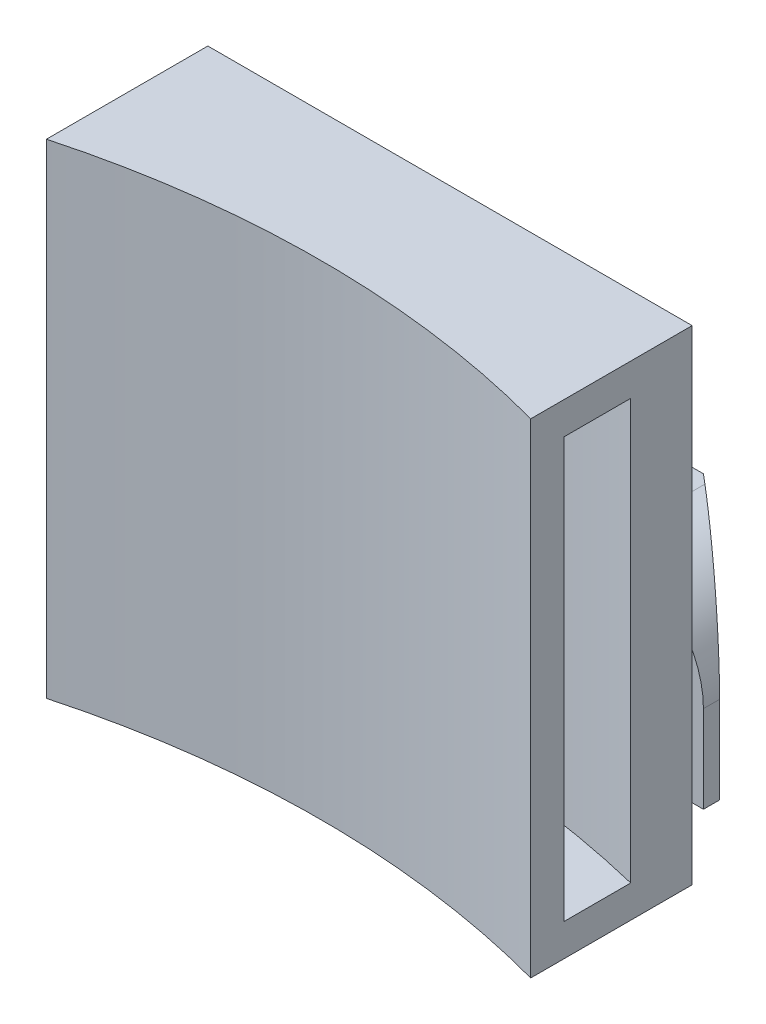
from build123d import *

# Parameters (mm, degrees)
BOSS_EXTRUDE1_DEPTH           = 7.5
CUT_EXTRUDE2_DEPTH            = 9.3
FILLET1_R                     = 3
FILLET2_R                     = 0.7
SKETCH3_W                     = 6
SKETCH3_H                     = 4
BOSS_EXTRUDE2_DEPTH           = 1
BOSS_EXTRUDE2_TAPER           = 45
SKETCH5_R                     = 0.75
BOSS_EXTRUDE3_DEPTH           = 0.6
BOSS_EXTRUDE3_DRAFT           = 35
BOSS_EXTRUDE3_PROFILE_2_DEPTH = 0.6
BOSS_EXTRUDE3_PROFILE_2_DRAFT = 35
CUT_EXTRUDE3_DEPTH            = 6.5


with BuildPart() as part:
    # Sketch1 → Boss-Extrude1 (new, symmetric)
    with BuildSketch(Plane(origin=(0, 0, 0), x_dir=(1, 0, 0), z_dir=(0, 1, 0))):
        with BuildLine():
            Line((-2.35, 5.5), (2.35, 5.5))
            Line((2.35, 5.5), (5.65, 2.7))
            Line((5.65, 2.7), (5.65, 2.2))
            Line((5.65, 2.2), (2.5, 2.2))
            Line((2.5, 2.2), (2.5, 0))
            Line((2.5, 0), (7.5, 0))
            Line((7.5, 0), (7.5, -5))
            ThreePointArc((7.5, -5), (0, -4), (-7.5, -5))
            Line((-7.5, -5), (-7.5, 0))
            Line((-7.5, 0), (-2.5, 0))
            Line((-2.5, 0), (-2.5, 2.2))
            Line((-2.5, 2.2), (-5.65, 2.2))
            Line((-5.65, 2.2), (-5.65, 2.7))
            Line((-5.65, 2.7), (-2.35, 5.5))
        make_face()
    extrude(amount=BOSS_EXTRUDE1_DEPTH, both=True)

    # Sketch2 → Cut-Extrude2 (cut)
    with BuildSketch(Plane(origin=(0, 7.5, 0), x_dir=(1, 0, 0), z_dir=(0, 1, 0))):
        Polygon((-2.5, 0), (2.5, 0), (2.5, 2.2), (5.65, 2.2), (5.65, 2.7), (2.35, 5.5), (-2.35, 5.5), (-5.65, 2.7), (-5.65, 2.2), (-2.5, 2.2), align=None)
    extrude(amount=-CUT_EXTRUDE2_DEPTH, mode=Mode.SUBTRACT)

    # Fillet1
    fillet1_edges = [part.edges().sort_by_distance(p)[0] for p in [
        (-2.5, -7.5, -1.1),
        (-5.65, -7.5, -2.45),
        (5.65, -1.8, -2.45),
        (2.5, -1.8, -1.1),
    ]]
    fillet(fillet1_edges, radius=FILLET1_R)

    # Fillet2
    # the kernel refuses this fillet: 0.7 mm, written as the material it adds along each edge
    with BuildSketch(Plane(origin=(-2.5, -4.5, 0), x_dir=(0, 0, -1), z_dir=(0, 1, 0)), Plane(origin=(-2.5, -1.8, -2.2), x_dir=(0, 0, 1), z_dir=(0, -1, 0)), Plane(origin=(2.5, -4.8, -2.2), x_dir=(1, 0, 0), z_dir=(0, -1, 0)), Plane(origin=(2.5, -4.8, 0), x_dir=(0, 0, -1), z_dir=(0, -1, 0))) as fillet2_piece_1:
        with BuildLine():
            CenterArc((FILLET2_R, FILLET2_R), FILLET2_R, 180, 90)
            Line((0, FILLET2_R), (0, 0))
            Line((0, 0), (FILLET2_R, 0))
        make_face()
    extrude(amount=2.7)
    with BuildSketch(Plane(origin=(-2.5, -1.8, 0), x_dir=(0, 0, -1), z_dir=(1, 0, 0))) as fillet2_piece_2:
        with BuildLine():
            CenterArc((FILLET2_R, FILLET2_R), FILLET2_R, 180, 90)
            Line((0, FILLET2_R), (0, 0))
            Line((0, 0), (FILLET2_R, 0))
        make_face()
    extrude(amount=2)
    with BuildSketch(Plane(origin=(0.5, -4.5, 0), x_dir=(-1, 0, 0), z_dir=(0, 1, 0))) as fillet2_piece_3_section:
        with BuildLine():
            CenterArc((3 + FILLET2_R, -FILLET2_R), FILLET2_R, 90, 90)
            Line((3 + FILLET2_R, 0), (3, 0))
            Line((3, 0), (3, -FILLET2_R))
        make_face()
    fillet2_piece_3 = revolve(axis=Axis((0.5, -4.5, 0), (0, 0, 1)), revolution_arc=146.841139064, mode=Mode.PRIVATE)
    fillet2_piece_3 = split(fillet2_piece_3, bisect_by=Plane(origin=(2.5, -4.5, 0), z_dir=(-1, 0, 0)), keep=Keep.TOP, mode=Mode.PRIVATE)
    fillet2_piece_3 = split(fillet2_piece_3, bisect_by=Plane(origin=(0.5, -7.5, 0), z_dir=(0, 1, 0)), keep=Keep.TOP, mode=Mode.PRIVATE)
    add(fillet2_piece_3)
    with BuildSketch(Plane(origin=(0.5, -4.5, -2.2), x_dir=(-1, 0, 0), z_dir=(0, 1, 0))) as fillet2_piece_4_section:
        with BuildLine():
            CenterArc((3 + FILLET2_R, FILLET2_R), FILLET2_R, 180, 90)
            Line((3, FILLET2_R), (3, 0))
            Line((3, 0), (3 + FILLET2_R, 0))
        make_face()
    fillet2_piece_4 = revolve(axis=Axis((0.5, -4.5, -2.2), (0, 0, 1)), revolution_arc=146.841139064, mode=Mode.PRIVATE)
    fillet2_piece_4 = split(fillet2_piece_4, bisect_by=Plane(origin=(2.5, -4.5, -2.2), z_dir=(-1, 0, 0)), keep=Keep.TOP, mode=Mode.PRIVATE)
    fillet2_piece_4 = split(fillet2_piece_4, bisect_by=Plane(origin=(0.5, -7.5, -2.2), z_dir=(0, 1, 0)), keep=Keep.TOP, mode=Mode.PRIVATE)
    add(fillet2_piece_4)
    with BuildSketch(Plane(origin=(-0.5, -4.8, 0), x_dir=(1, 0, 0), z_dir=(0, -1, 0))) as fillet2_piece_5:
        with BuildLine():
            CenterArc((3 + FILLET2_R, -FILLET2_R), FILLET2_R, 90, 90)
            Line((3 + FILLET2_R, 0), (3, 0))
            Line((3, 0), (3, -FILLET2_R))
        make_face()
    revolve(axis=Axis((-0.5, -4.8, 0), (0, 0, 1)), revolution_arc=90)
    with BuildSketch(Plane(origin=(-0.5, -4.8, -2.2), x_dir=(1, 0, 0), z_dir=(0, -1, 0))) as fillet2_piece_6_section:
        with BuildLine():
            CenterArc((3 + FILLET2_R, FILLET2_R), FILLET2_R, 180, 90)
            Line((3, FILLET2_R), (3, 0))
            Line((3, 0), (3 + FILLET2_R, 0))
        make_face()
    fillet2_piece_6 = revolve(axis=Axis((-0.5, -4.8, -2.2), (0, 0, 1)), revolution_arc=146.841139064, mode=Mode.PRIVATE)
    fillet2_piece_6 = split(fillet2_piece_6, bisect_by=Plane(origin=(-2.5, -4.8, -2.2), z_dir=(1, 0, 0)), keep=Keep.TOP, mode=Mode.PRIVATE)
    fillet2_piece_6 = split(fillet2_piece_6, bisect_by=Plane(origin=(-0.5, -1.8, -2.2), z_dir=(0, -1, 0)), keep=Keep.TOP, mode=Mode.PRIVATE)
    add(fillet2_piece_6)
    with BuildSketch(Plane(origin=(-2.5, -4.5, 0), x_dir=(0, 0, -1), z_dir=(0, 1, 0))) as fillet2_piece_7a_section:
        with BuildLine():
            CenterArc((FILLET2_R, FILLET2_R), FILLET2_R, 180, 90)
            Line((0, FILLET2_R), (0, 0))
            Line((0, 0), (FILLET2_R, 0))
        make_face()
    fillet2_piece_7a = extrude(amount=4.45, mode=Mode.PRIVATE)
    fillet2_piece_7a = split(fillet2_piece_7a, bisect_by=Plane(origin=(-2.5, -1.8, 0), z_dir=(0, 1, 0)), keep=Keep.TOP, mode=Mode.PRIVATE)
    with BuildSketch(Plane(origin=(-4.25, -1.8, 0), x_dir=(0, 0, -1), z_dir=(1, 0, 0))) as fillet2_piece_7b_section:
        with BuildLine():
            CenterArc((FILLET2_R, FILLET2_R), FILLET2_R, 180, 90)
            Line((0, FILLET2_R), (0, 0))
            Line((0, 0), (FILLET2_R, 0))
        make_face()
    fillet2_piece_7b = extrude(amount=3.75, mode=Mode.PRIVATE)
    fillet2_piece_7b = split(fillet2_piece_7b, bisect_by=Plane(origin=(-2.5, -1.8, 0), z_dir=(-1, 0, 0)), keep=Keep.TOP, mode=Mode.PRIVATE)
    fillet2_piece_7 = fillet2_piece_7a & fillet2_piece_7b
    add(fillet2_piece_7)

    # Sketch3 → Boss-Extrude2 (add)
    with BuildSketch(Plane(origin=(0, 0, 0), x_dir=(-1, 0, 0), z_dir=(0, 0, -1))):
        with Locations((0, 5.5)):
            Rectangle(SKETCH3_W, SKETCH3_H)
    extrude(amount=BOSS_EXTRUDE2_DEPTH, taper=BOSS_EXTRUDE2_TAPER)


with BuildPart() as boss_extrude3_tool:
    # Sketch5 → Boss-Extrude3 (with draft: the straight prism first)
    with BuildSketch(Plane(origin=(0, 0, 0), x_dir=(-1, 0, 0), z_dir=(0, 0, -1))):
        with Locations((6, 5.5)):
            Circle(SKETCH5_R)
    extrude(amount=BOSS_EXTRUDE3_DEPTH)
    # Boss-Extrude3: the draft: its side faces are tilted about the plane it starts from
    boss_extrude3_sides = [boss_extrude3_tool.faces().sort_by_distance(p)[0] for p in [
        (-5.25, 5.5, -0.3),
    ]]
    draft(boss_extrude3_sides, Plane(origin=(0, 0, 0), x_dir=(-1, 0, 0), z_dir=(0, 0, -1)), BOSS_EXTRUDE3_DRAFT)


with BuildPart() as part_1:
    add(part.part)

    # Boss-Extrude3: add boss_extrude3_tool
    add(boss_extrude3_tool.part)


with BuildPart() as boss_extrude3_profile_2_tool:
    # Sketch5 → Boss-Extrude3 profile 2 (with draft: the straight prism first)
    with BuildSketch(Plane(origin=(0, 0, 0), x_dir=(-1, 0, 0), z_dir=(0, 0, -1))):
        with Locations((-6, 5.5)):
            Circle(SKETCH5_R)
    extrude(amount=BOSS_EXTRUDE3_PROFILE_2_DEPTH)
    # Boss-Extrude3 profile 2: the draft: its side faces are tilted about the plane it starts from
    boss_extrude3_profile_2_sides = [boss_extrude3_profile_2_tool.faces().sort_by_distance(p)[0] for p in [
        (6.75, 5.5, -0.3),
    ]]
    draft(boss_extrude3_profile_2_sides, Plane(origin=(0, 0, 0), x_dir=(-1, 0, 0), z_dir=(0, 0, -1)), BOSS_EXTRUDE3_PROFILE_2_DRAFT)


with BuildPart() as part_2:
    add(part_1.part)

    # Boss-Extrude3 profile 2: add boss_extrude3_profile_2_tool
    add(boss_extrude3_profile_2_tool.part)

    # Sketch6 → Cut-Extrude3 (cut, symmetric)
    with BuildSketch(Plane(origin=(0, 0, 0), x_dir=(1, 0, 0), z_dir=(0, 1, 0))):
        with BuildLine():
            Line((-7.5, -1.902196987), (-7.5, -3.965086794))
            ThreePointArc((-7.5, -3.965086794), (0, -3), (7.5, -3.965086794))
            Line((7.5, -3.965086794), (7.5, -1.902196987))
            ThreePointArc((7.5, -1.902196987), (0, -1), (-7.5, -1.902196987))
        make_face()
    extrude(amount=CUT_EXTRUDE3_DEPTH, both=True, mode=Mode.SUBTRACT)


solid = part_2.part
